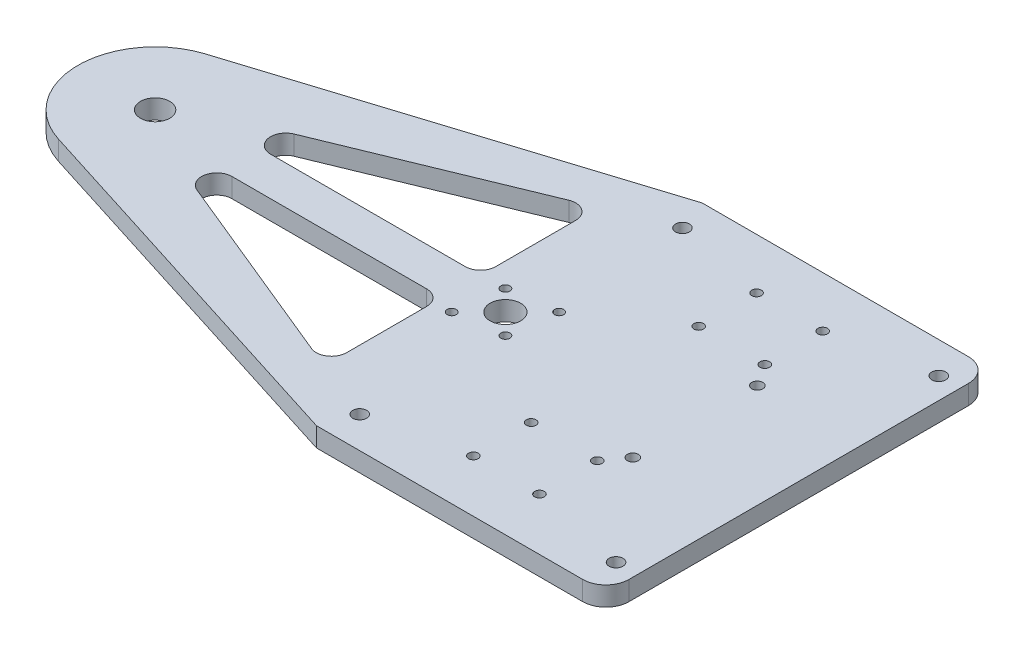
from build123d import *

# Parameters (mm, degrees)
SKETCH1_W           = 95.25
SKETCH1_H           = 127
BOSS_EXTRUDE1_DEPTH = 6.35
BOSS_EXTRUDE3_DEPTH = 6.35
SKETCH5_R           = 4.826
SKETCH5_R_2         = 5.039999953
SKETCH5_R_3         = 1.5
CUT_EXTRUDE1_DEPTH  = 201.11039673
CUT_EXTRUDE2_DEPTH  = 201.11039673
FILLET9_R           = 5
FILLET10_R          = 7.62
SKETCH7_R           = 2.2812375
CUT_EXTRUDE3_DEPTH  = 201.11039673
SKETCH8_R           = 1.5875
CUT_EXTRUDE4_DEPTH  = 201.11039673
SKETCH9_R           = 1.830008083
CUT_EXTRUDE5_DEPTH  = 201.11039673


with BuildPart() as part:
    # Sketch1 → Boss-Extrude1 (new body)
    with BuildSketch(Plane(origin=(0, 0, 0), x_dir=(1, 0, 0), z_dir=(0, 1, 0))):
        Rectangle(SKETCH1_W, SKETCH1_H)
    extrude(amount=BOSS_EXTRUDE1_DEPTH)

    # Sketch4 → Boss-Extrude3 (add)
    with BuildSketch(Plane(origin=(0, 6.35, 0), x_dir=(1, 0, 0), z_dir=(0, 1, 0))):
        with BuildLine():
            Line((-47.625, 63.5), (-171.916018217, 24.219268021))
            ThreePointArc((-171.916018217, 24.219268021), (-189.6618, 0), (-171.916018217, -24.219268021))
            Line((-171.916018217, -24.219268021), (-47.625, -63.5))
            Line((-47.625, -63.5), (-47.625, 63.5))
        make_face()
    extrude(amount=-BOSS_EXTRUDE3_DEPTH)

    # Sketch5 → Cut-Extrude1 (cut, through all)
    with BuildSketch(Plane(origin=(0, 6.35, 0), x_dir=(1, 0, 0), z_dir=(0, 1, 0))):
        with Locations((-164.2618, 0)):
            Circle(SKETCH5_R)
        with Locations((-48.9458, 0)):
            Circle(SKETCH5_R_2)
        with Locations((-42.228285579, -6.717514421)):
            Circle(SKETCH5_R_3)
        with Locations((-40.106965235, 8.838834765)):
            Circle(SKETCH5_R_3)
        with Locations((-57.784634765, -8.838834765)):
            Circle(SKETCH5_R_3)
        with Locations((-55.663314421, 6.717514421)):
            Circle(SKETCH5_R_3)
    extrude(amount=-CUT_EXTRUDE1_DEPTH, mode=Mode.SUBTRACT)

    # Sketch6 → Cut-Extrude2 (cut, through all)
    with BuildSketch(Plane(origin=(0, 6.35, 0), x_dir=(1, 0, 0), z_dir=(0, 1, 0))):
        Polygon((-63.5, 45.163743355), (-157.9118, 6.35), (-63.5, 6.35), align=None)
        Polygon((-63.5, -6.35), (-63.5, -45.163743355), (-157.9118, -6.35), align=None)
    extrude(amount=-CUT_EXTRUDE2_DEPTH, mode=Mode.SUBTRACT)

    # Fillet9
    fillet9_edges = [part.edges().sort_by_distance(p)[0] for p in [
        (-157.9118, 3.175, 6.35),
        (-63.5, 3.175, 6.35),
        (-63.5, 3.175, 45.163743355),
        (-63.5, 3.175, -6.35),
        (-157.9118, 3.175, -6.35),
        (-63.5, 3.175, -45.163743355),
    ]]
    fillet(fillet9_edges, radius=FILLET9_R)

    # Fillet10
    fillet10_edges = [part.edges().sort_by_distance(p)[0] for p in [
        (47.625, 3.175, -63.5),
        (47.625, 3.175, 63.5),
    ]]
    fillet(fillet10_edges, radius=FILLET10_R)

    # Sketch7 → Cut-Extrude3 (cut, through all)
    with BuildSketch(Plane(origin=(0, 6.35, 0), x_dir=(1, 0, 0), z_dir=(0, 1, 0))):
        with Locations((-43.777254611, -53.125383493)):
            Circle(SKETCH7_R)
        with Locations((-43.777254611, 53.125383493)):
            Circle(SKETCH7_R)
        with Locations((40.602254611, 53.125383493)):
            Circle(SKETCH7_R)
        with Locations((40.602254611, -53.125383493)):
            Circle(SKETCH7_R)
    extrude(amount=-CUT_EXTRUDE3_DEPTH, mode=Mode.SUBTRACT)

    # Sketch8 → Cut-Extrude4 (cut, through all)
    with BuildSketch(Plane(origin=(0, 6.35, 0), x_dir=(1, 0, 0), z_dir=(0, 1, 0))):
        with Locations((-13.209796215, -27.25)):
            Circle(SKETCH8_R)
        with Locations((8.564628211, -27.25)):
            Circle(SKETCH8_R)
        with Locations((8.564628211, -46.3)):
            Circle(SKETCH8_R)
        with Locations((-13.209796215, -46.3)):
            Circle(SKETCH8_R)
        with Locations((8.717854945, 46.8)):
            Circle(SKETCH8_R)
        with Locations((-13.056569481, 27.75)):
            Circle(SKETCH8_R)
        with Locations((-13.056569481, 46.8)):
            Circle(SKETCH8_R)
        with Locations((8.717854945, 27.75)):
            Circle(SKETCH8_R)
    extrude(amount=-CUT_EXTRUDE4_DEPTH, mode=Mode.SUBTRACT)

    # Sketch9 → Cut-Extrude5 (cut, through all)
    with BuildSketch(Plane(origin=(0, 6.35, 0), x_dir=(1, 0, 0), z_dir=(0, 1, 0))):
        with Locations((13.499388849, -20.49783886)):
            Circle(SKETCH9_R)
        with Locations((13.49951585, 20.502576943)):
            Circle(SKETCH9_R)
    extrude(amount=-CUT_EXTRUDE5_DEPTH, mode=Mode.SUBTRACT)


solid = part.part
